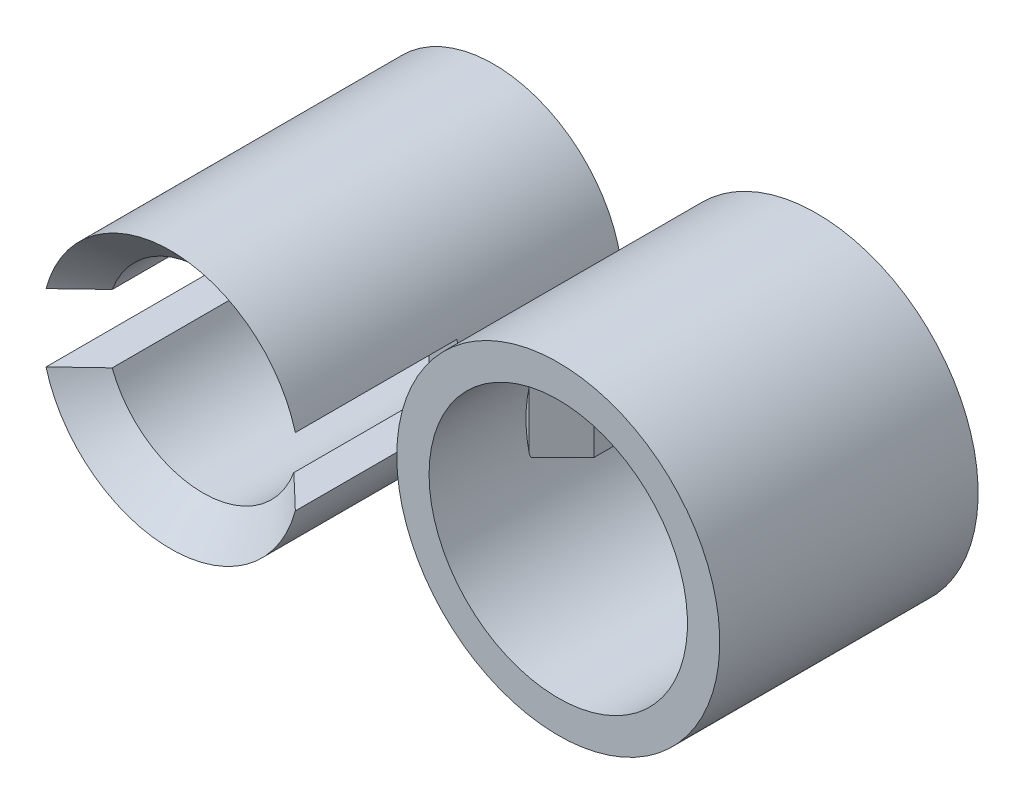
from build123d import *

# Parameters (mm, degrees)
SKETCH1_R           = 4
SKETCH1_R_2         = 3
BOSS_EXTRUDE1_DEPTH = 10
SKETCH2_W           = 8
SKETCH2_H           = 2.1
CUT_EXTRUDE1_DEPTH  = 5
SKETCH3_R           = 5
SKETCH3_R_2         = 4
BOSS_EXTRUDE2_DEPTH = 8
BOSS_EXTRUDE3_DEPTH = 5
CHAMFER1_SIZE       = 1
CHAMFER2_SIZE       = 1


with BuildPart() as part:
    # Sketch1 → Boss-Extrude1 (new body)
    with BuildSketch(Plane.XY):
        Circle(SKETCH1_R)
        Circle(SKETCH1_R_2, mode=Mode.SUBTRACT)
    extrude(amount=BOSS_EXTRUDE1_DEPTH)

    # Sketch2 → Cut-Extrude1 (cut)
    with BuildSketch(Plane.XY.offset(10)):
        Rectangle(SKETCH2_W, SKETCH2_H)
    extrude(amount=-CUT_EXTRUDE1_DEPTH, mode=Mode.SUBTRACT)

    # Chamfer2
    chamfer2_edges = [part.edges().sort_by_distance(p)[0] for p in [
        (0, -3, 10),
        (0, 3, 10),
    ]]
    chamfer(chamfer2_edges, length=CHAMFER2_SIZE - 0.0001)  # a hair under: the kernel refuses the full size


with BuildPart() as body_2:
    # Sketch3 → Boss-Extrude2 (new body)
    with BuildSketch(Plane(origin=(0, 0, 0), x_dir=(-1, 0, 0), z_dir=(0, 0, -1))):
        with Locations((-10, 0)):
            Circle(SKETCH3_R)
        with Locations((-10, 0)):
            Circle(SKETCH3_R_2, mode=Mode.SUBTRACT)
    extrude(amount=-BOSS_EXTRUDE2_DEPTH)

    # Sketch4 → Boss-Extrude3 (add)
    with BuildSketch(Plane(origin=(0, 0, 0), x_dir=(-1, 0, 0), z_dir=(0, 0, -1))):
        with BuildLine():
            Line((-13.872983346, -1), (-12.898979486, -1))
            Line((-12.898979486, -1), (-12.898979486, 1))
            Line((-12.898979486, 1), (-13.872983346, 1))
            ThreePointArc((-13.872983346, 1), (-14, 0), (-13.872983346, -1))
        make_face()
        with BuildLine():
            Line((-7.101020514, 1), (-7.101020514, -1))
            Line((-7.101020514, -1), (-6.127016654, -1))
            ThreePointArc((-6.127016654, -1), (-6.031881215, -0.50401717), (-6, 0))
            ThreePointArc((-6, 0), (-6.031881215, 0.50401717), (-6.127016654, 1))
            Line((-6.127016654, 1), (-7.101020514, 1))
        make_face()
    extrude(amount=-BOSS_EXTRUDE3_DEPTH)

    # Chamfer1
    chamfer1_edges = [body_2.edges().sort_by_distance(p)[0] for p in [
        (12.898979486, 0, 5),
        (7.101020514, 0, 5),
    ]]
    chamfer(chamfer1_edges, length=CHAMFER1_SIZE)


solid = Compound([part.part, body_2.part])
